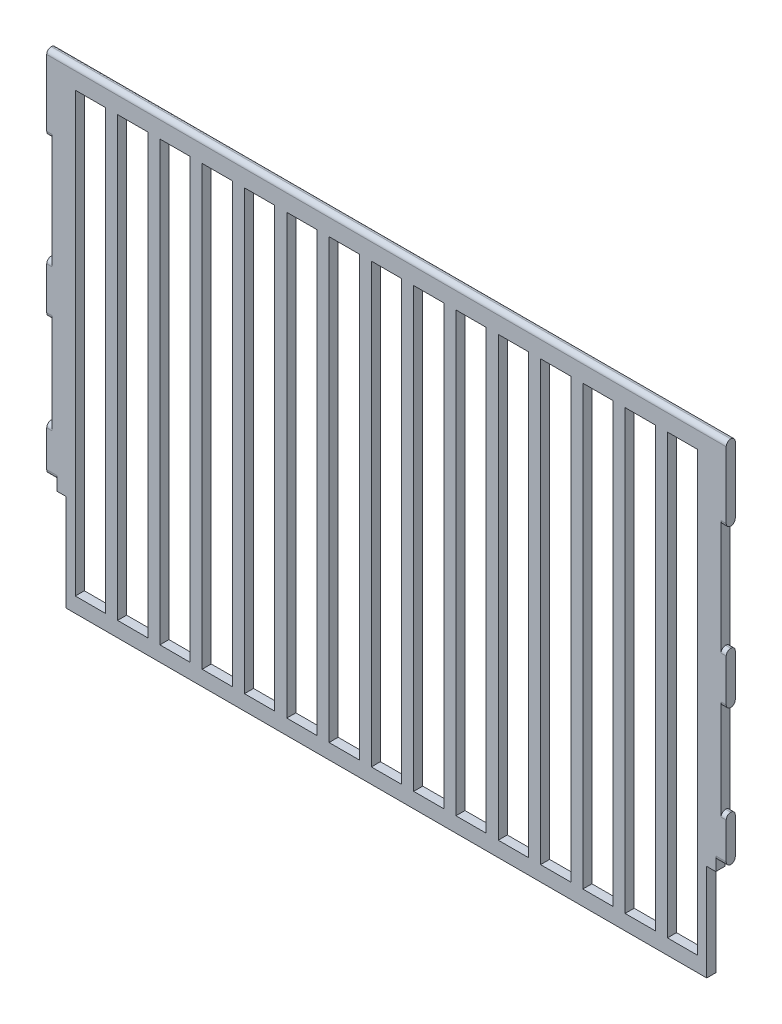
from build123d import *

# Parameters (mm, degrees)
SKETCH_1_W      = 10
SKETCH_1_H      = 145
EXTRUDE_1_DEPTH = 3
FILLET_1_R      = 1.5


with BuildPart() as part:
    # 草图1 → 凸台-拉伸1 (new body)
    with BuildSketch(Plane.XY):
        Polygon((110.75, 71), (-110.75, 71), (-112.45, 71), (-112.45, 46), (-110.75, 46), (-110.75, 11), (-112.45, 11), (-112.45, -6), (-110.75, -6), (-110.75, -36), (-112.45, -36), (-112.45, -51), (-109, -51), (-109, -54), (-106, -54), (-106, -71), (-106, -86), (106, -86), (106, -71), (106, -54), (109, -54), (109, -51), (112.45, -51), (112.45, -36), (110.75, -36), (110.75, -6), (112.45, -6), (112.45, 11), (110.75, 11), (110.75, 46), (112.45, 46), (112.45, 71), align=None)
        with Locations((0, -8.5)):
            Rectangle(SKETCH_1_W, SKETCH_1_H, mode=Mode.SUBTRACT)
        with Locations((14, -8.5)):
            Rectangle(SKETCH_1_W, SKETCH_1_H, mode=Mode.SUBTRACT)
        with Locations((28, -8.5)):
            Rectangle(SKETCH_1_W, SKETCH_1_H, mode=Mode.SUBTRACT)
        with Locations((42, -8.5)):
            Rectangle(SKETCH_1_W, SKETCH_1_H, mode=Mode.SUBTRACT)
        with Locations((56, -8.5)):
            Rectangle(SKETCH_1_W, SKETCH_1_H, mode=Mode.SUBTRACT)
        with Locations((70, -8.5)):
            Rectangle(SKETCH_1_W, SKETCH_1_H, mode=Mode.SUBTRACT)
        with Locations((84, -8.5)):
            Rectangle(SKETCH_1_W, SKETCH_1_H, mode=Mode.SUBTRACT)
        with Locations((98, -8.5)):
            Rectangle(SKETCH_1_W, SKETCH_1_H, mode=Mode.SUBTRACT)
        with Locations((-14, -8.5)):
            Rectangle(SKETCH_1_W, SKETCH_1_H, mode=Mode.SUBTRACT)
        with Locations((-28, -8.5)):
            Rectangle(SKETCH_1_W, SKETCH_1_H, mode=Mode.SUBTRACT)
        with Locations((-42, -8.5)):
            Rectangle(SKETCH_1_W, SKETCH_1_H, mode=Mode.SUBTRACT)
        with Locations((-56, -8.5)):
            Rectangle(SKETCH_1_W, SKETCH_1_H, mode=Mode.SUBTRACT)
        with Locations((-70, -8.5)):
            Rectangle(SKETCH_1_W, SKETCH_1_H, mode=Mode.SUBTRACT)
        with Locations((-84, -8.5)):
            Rectangle(SKETCH_1_W, SKETCH_1_H, mode=Mode.SUBTRACT)
        with Locations((-98, -8.5)):
            Rectangle(SKETCH_1_W, SKETCH_1_H, mode=Mode.SUBTRACT)
    extrude(amount=EXTRUDE_1_DEPTH)

    # 圆角1
    fillet_1_edges = [part.edges().sort_by_distance(p)[0] for p in [
        (111.6, -6, 3),
        (111.6, -6, 0),
        (110.725, -51, 0),
        (110.725, -51, 3),
        (111.6, -36, 0),
        (111.6, -36, 3),
        (111.6, 11, 3),
        (111.6, 11, 0),
        (111.6, 46, 0),
        (111.6, 46, 3),
        (0, 71, 0),
        (0, 71, 3),
        (-111.6, 11, 0),
        (-111.6, 11, 3),
        (-111.6, -6, 0),
        (-111.6, -6, 3),
        (-111.6, 46, 0),
        (-111.6, 46, 3),
        (-111.6, -36, 0),
        (-111.6, -36, 3),
        (-110.725, -51, 0),
        (-110.725, -51, 3),
    ]]
    fillet(fillet_1_edges, radius=FILLET_1_R - 0.0001)  # a hair under: the kernel refuses the full size


solid = part.part
